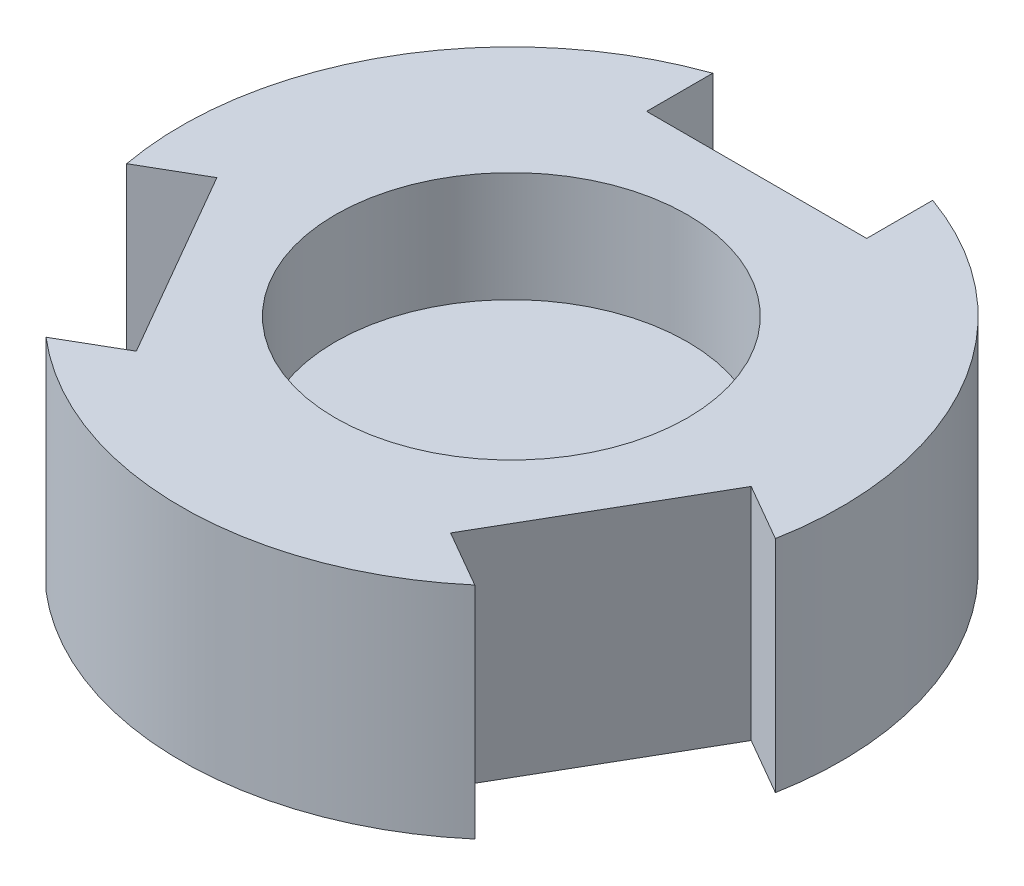
from build123d import *

# Parameters (mm, degrees)
SKETCH1_R           = 15
BOSS_EXTRUDE1_DEPTH = 10
SKETCH2_R           = 8
CUT_EXTRUDE1_DEPTH  = 5
CUT_EXTRUDE2_REACH  = 25.452


with BuildPart() as part:
    # Sketch1 → Boss-Extrude1 (new body)
    with BuildSketch(Plane(origin=(0, 0, 0), x_dir=(1, 0, 0), z_dir=(0, 1, 0))):
        Circle(SKETCH1_R)
    extrude(amount=BOSS_EXTRUDE1_DEPTH)

    # Sketch2 → Cut-Extrude1 (cut)
    with BuildSketch(Plane(origin=(0, 10, 0), x_dir=(1, 0, 0), z_dir=(0, 1, 0))):
        Circle(SKETCH2_R)
    extrude(amount=-CUT_EXTRUDE1_DEPTH, mode=Mode.SUBTRACT)

    # Sketch3 → Cut-Extrude2 (cut, up to next)
    with BuildSketch(Plane(origin=(0, 10, 0), x_dir=(1, 0, 0), z_dir=(0, 1, 0)), mode=Mode.PRIVATE) as cut_extrude2_sk1:
        Polygon((-4.993128311, 14.139704236), (-4.993128311, 16.53849836), (5.006871689, 16.53849836), (5.006871689, 14.139704236), (5.006871689, 11.139704236), (-4.993128311, 11.139704236), align=None)
    cut_extrude2_tool1 = extrude(cut_extrude2_sk1.sketch, amount=-CUT_EXTRUDE2_REACH, mode=Mode.PRIVATE) & part.part
    # Sketch3 → Cut-Extrude2 (cut, up to next)
    with BuildSketch(Plane(origin=(0, 10, 0), x_dir=(1, 0, 0), z_dir=(0, 1, 0)), mode=Mode.PRIVATE) as cut_extrude2_sk2:
        Polygon((9.741907226, -11.405930195), (7.143831014, -9.905930195), (12.143831014, -1.245676157), (14.741907226, -2.745676157), (16.819323876, -3.945073219), (11.819323876, -12.605327257), align=None)
    cut_extrude2_tool2 = extrude(cut_extrude2_sk2.sketch, amount=-CUT_EXTRUDE2_REACH, mode=Mode.PRIVATE) & part.part
    # Sketch3 → Cut-Extrude2 (cut, up to next)
    with BuildSketch(Plane(origin=(0, 10, 0), x_dir=(1, 0, 0), z_dir=(0, 1, 0)), mode=Mode.PRIVATE) as cut_extrude2_sk3:
        Polygon((-14.748778915, -2.733774042), (-12.150702704, -1.233774042), (-7.150702704, -9.894028079), (-9.748778915, -11.394028079), (-11.826195565, -12.593425141), (-16.826195565, -3.933171104), align=None)
    cut_extrude2_tool3 = extrude(cut_extrude2_sk3.sketch, amount=-CUT_EXTRUDE2_REACH, mode=Mode.PRIVATE) & part.part
    add(cut_extrude2_tool1.solids().sort_by_distance((0.006872, 10, -13.839101))[0], mode=Mode.SUBTRACT)
    add(cut_extrude2_tool2.solids().sort_by_distance((11.981577, 10, 6.925502))[0], mode=Mode.SUBTRACT)
    add(cut_extrude2_tool3.solids().sort_by_distance((-11.988449, 10, 6.9136))[0], mode=Mode.SUBTRACT)


solid = part.part
